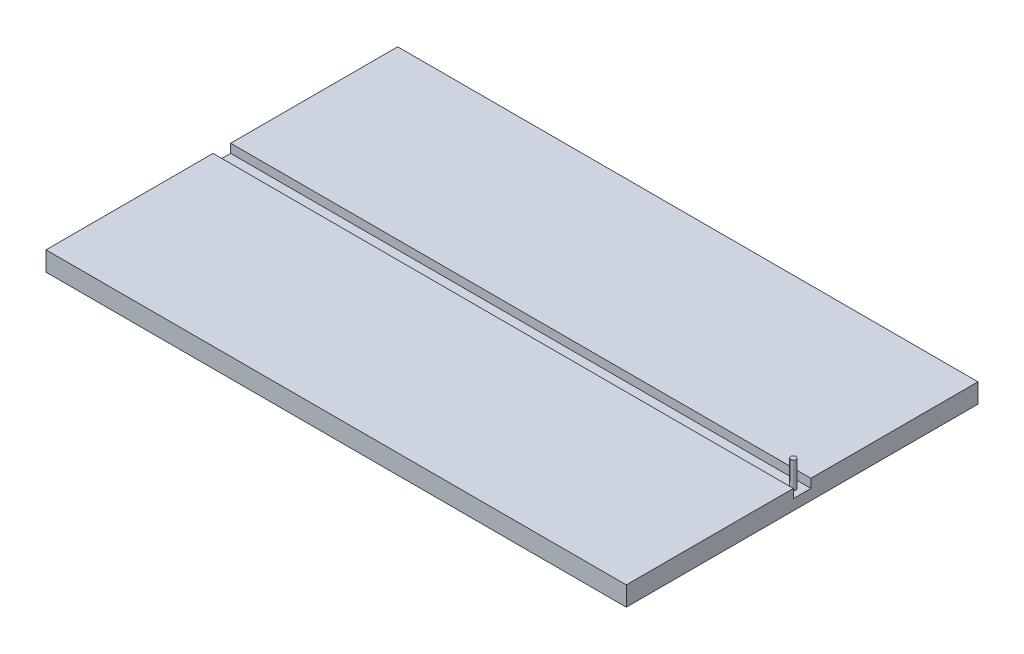
from build123d import *

# Parameters (mm, degrees)
SKETCH1_W           = 330
SKETCH1_H           = 200
BOSS_EXTRUDE1_DEPTH = 6
SKETCH2_W           = 330
SKETCH2_H           = 95
BOSS_EXTRUDE2_DEPTH = 5
SKETCH3_R           = 1.5
BOSS_EXTRUDE3_DEPTH = 15


with BuildPart() as part:
    # Sketch1 → Boss-Extrude1 (new body)
    with BuildSketch(Plane(origin=(0, 0, 0), x_dir=(1, 0, 0), z_dir=(0, 1, 0))):
        with Locations((165, 100)):
            Rectangle(SKETCH1_W, SKETCH1_H)
    extrude(amount=BOSS_EXTRUDE1_DEPTH)

    # Sketch2 → Boss-Extrude2 (add)
    with BuildSketch(Plane(origin=(0, 6, 0), x_dir=(1, 0, 0), z_dir=(0, 1, 0))):
        with Locations((165, 47.5)):
            Rectangle(SKETCH2_W, SKETCH2_H)
        with Locations((165, 152.5)):
            Rectangle(SKETCH2_W, SKETCH2_H)
    extrude(amount=BOSS_EXTRUDE2_DEPTH)

    # Sketch3 → Boss-Extrude3 (add)
    with BuildSketch(Plane(origin=(0, 6, 0), x_dir=(1, 0, 0), z_dir=(0, 1, 0))):
        with Locations((325, 100)):
            Circle(SKETCH3_R)
    extrude(amount=BOSS_EXTRUDE3_DEPTH)


solid = part.part
